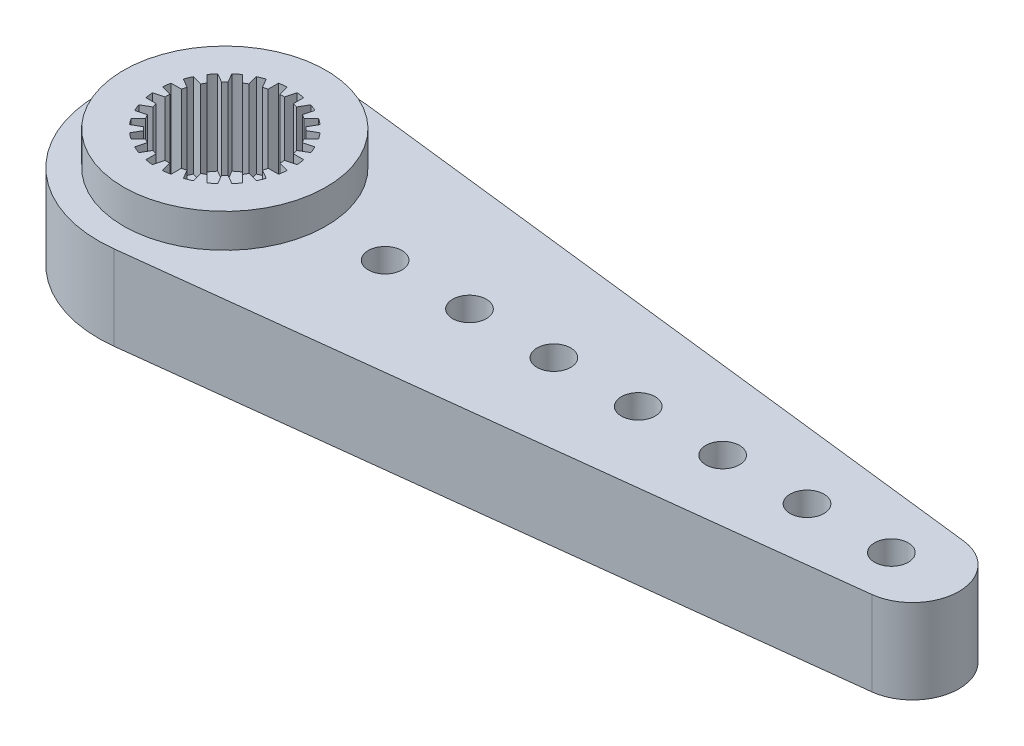
from build123d import *

# Parameters (mm, degrees)
ESQUISSE1_R                  = 1.6
BOSS_EXTRU_1_DEPTH           = 8
ESQUISSE2_R                  = 1
ENL_V_MAT_EXTRU_1_DEPTH      = 8
R_P_TITION_LIN_AIRE1_COUNT   = 7
R_P_TITION_LIN_AIRE1_PITCH   = 5
ESQUISSE3_W                  = 63.02569825
ESQUISSE3_H                  = 22.447508966
ESQUISSE3_R                  = 6
ENL_V_MAT_EXTRU_2_DEPTH      = 2
ESQUISSE4_W                  = 65.150237544
ESQUISSE4_H                  = 23.585889013
ESQUISSE4_R                  = 4.65
ENL_V_MAT_EXTRU_3_DEPTH      = 1
ESQUISSE5_R                  = 2.75
ENL_V_MAT_EXTRU_4_DEPTH      = 1
CHANFREIN1_SIZE              = 1
ESQUISSE6_R                  = 4
ENL_V_MAT_EXTRU_5_DEPTH      = 5
BOSS_EXTRU_2_DEPTH           = 5
R_P_TITION_CIRCULAIRE1_COUNT = 24


with BuildPart() as part:
    # Esquisse1 → Boss.-Extru.1 (new body)
    with BuildSketch(Plane(origin=(0, 0, 0), x_dir=(1, 0, 0), z_dir=(0, 1, 0))):
        with BuildLine():
            Line((0.874233129, -7.448873501), (41.070552147, -2.731253617))
            ThreePointArc((41.070552147, -2.731253617), (43.5, 0), (41.070552147, 2.731253617))
            Line((41.070552147, 2.731253617), (0.874233129, 7.448873501))
            ThreePointArc((0.874233129, 7.448873501), (-7.5, 0), (0.874233129, -7.448873501))
        make_face()
        with Locations(Location((0, 0, 0), (0, 0, 270))):
            Circle(ESQUISSE1_R, mode=Mode.SUBTRACT)
    extrude(amount=BOSS_EXTRU_1_DEPTH)

    # Esquisse2 → Enlèv. mat.-Extru.1 (cut)
    with BuildSketch(Plane(origin=(0, 8, 0), x_dir=(1, 0, 0), z_dir=(0, 1, 0))):
        with Locations(Location((9.5, 0, 0), (0, 0, 270))):
            Circle(ESQUISSE2_R)
    enl_v_mat_extru_1 = extrude(amount=-ENL_V_MAT_EXTRU_1_DEPTH, mode=Mode.SUBTRACT)

    # Répétition linéaire1: Enlèv. mat.-Extru.1 ×7
    with Locations(*[(i * R_P_TITION_LIN_AIRE1_PITCH, 0, 0) for i in range(1, R_P_TITION_LIN_AIRE1_COUNT)]):
        add(enl_v_mat_extru_1, mode=Mode.SUBTRACT)

    # Esquisse3 → Enlèv. mat.-Extru.2 (cut)
    with BuildSketch(Plane(origin=(0, 8, 0), x_dir=(1, 0, 0), z_dir=(0, 1, 0))):
        with Locations((18.729808022, -1.006570064)):
            Rectangle(ESQUISSE3_W, ESQUISSE3_H)
        with Locations(Location((0, 0, 0), (0, 0, 270))):
            Circle(ESQUISSE3_R, mode=Mode.SUBTRACT)
    extrude(amount=-ENL_V_MAT_EXTRU_2_DEPTH, mode=Mode.SUBTRACT)

    # Esquisse4 → Enlèv. mat.-Extru.3 (cut)
    with BuildSketch(Plane.XZ):
        with Locations((19.098187779, 0.565848797)):
            Rectangle(ESQUISSE4_W, ESQUISSE4_H)
        with Locations(Location((0, 0, 0), (0, 0, 270))):
            Circle(ESQUISSE4_R, mode=Mode.SUBTRACT)
    extrude(amount=-ENL_V_MAT_EXTRU_3_DEPTH, mode=Mode.SUBTRACT)

    # Esquisse5 → Enlèv. mat.-Extru.4 (cut)
    with BuildSketch(Plane.XZ):
        with Locations(Location((0, 0, 0), (0, 0, 270))):
            Circle(ESQUISSE5_R)
    extrude(amount=-ENL_V_MAT_EXTRU_4_DEPTH, mode=Mode.SUBTRACT)

    # Chanfrein1
    chanfrein1_edges = [part.edges().sort_by_distance(p)[0] for p in [
        (0, 1, 4.65),
    ]]
    chamfer(chanfrein1_edges, length=CHANFREIN1_SIZE - 0.0001)  # a hair under: the kernel refuses the full size

    # Esquisse6 → Enlèv. mat.-Extru.5 (cut)
    with BuildSketch(Plane(origin=(0, 8, 0), x_dir=(1, 0, 0), z_dir=(0, 1, 0))):
        with Locations(Location((0, 0, 0), (0, 0, 270))):
            Circle(ESQUISSE6_R)
    extrude(amount=-ENL_V_MAT_EXTRU_5_DEPTH, mode=Mode.SUBTRACT)

    # Esquisse7 → Boss.-Extru.2 (add)
    with BuildSketch(Plane(origin=(0, 8, 0), x_dir=(1, 0, 0), z_dir=(0, 1, 0))):
        Polygon((0.3, -4), (0.139230485, -3.4), (-0.139230485, -3.4), (-0.3, -4), align=None)
    boss_extru_2 = extrude(amount=-BOSS_EXTRU_2_DEPTH)

    # Répétition circulaire1: Boss.-Extru.2 ×24 about axis
    r_p_tition_circulaire1_axis = Axis((0, 0, 0), (0, 1, 0))
    for i in range(1, R_P_TITION_CIRCULAIRE1_COUNT):
        add(boss_extru_2.rotate(r_p_tition_circulaire1_axis, i * 360 / R_P_TITION_CIRCULAIRE1_COUNT))


solid = part.part
